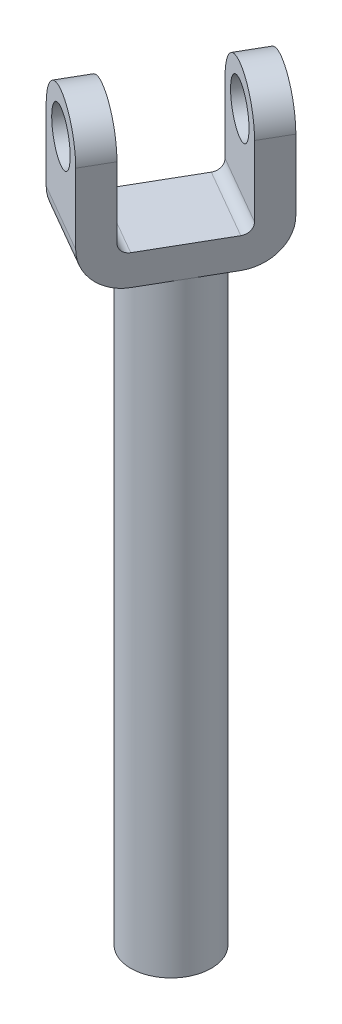
from build123d import *

# Parameters (mm, degrees)
BASE_LINK_OUTLINE_R     = 5
BASE_LINK_OUTLINE_R_2   = 4
BASE_LINK_DEPTH         = 60
SKETCH3_R               = 4
BOSS_EXTRUDE1_DEPTH     = 60
BOSS_EXTRUDE2_DEPTH     = 4
CUT_EXTRUDE1_DEPTH      = 78.510329968
CUT_EXTRUDE1_DEPTH_BACK = 78.510329968
SKETCH5_R               = 2.5


# Read off the part's stored shape, not the designer's step: base_link
with BuildPart() as part:
    # base_link outline → base_link (new body)
    with BuildSketch(Plane(origin=(0, 0, 0), x_dir=(1, 0, 0), z_dir=(0, 1, 0))):
        with Locations((30.34635, 52.561420024)):
            Circle(BASE_LINK_OUTLINE_R)
        with Locations((30.34635, 52.561420024)):
            Circle(BASE_LINK_OUTLINE_R_2, mode=Mode.SUBTRACT)
    extrude(amount=BASE_LINK_DEPTH)


with BuildPart() as body_2:
    # Sketch3 → Boss-Extrude1 (new body)
    with BuildSketch(Plane(origin=(0, 0, 0), x_dir=(1, 0, 0), z_dir=(0, 1, 0))):
        with Locations(Location((30.34635, 52.561420024, 0), (0, 0, 270))):
            Circle(SKETCH3_R)
    extrude(amount=BOSS_EXTRUDE1_DEPTH)

    # Sketch4 → Boss-Extrude2 (add, symmetric)
    with BuildSketch(Plane(origin=(0, 0, 0), x_dir=(-0.49999999999999994, 0, 0.8660254037844387), z_dir=(-0.8660254037844386, 0, -0.4999999999999999))):
        with BuildLine():
            Line((-68.6927, 75), (-65.6927, 75))
            Line((-65.6927, 75), (-65.6927, 64))
            ThreePointArc((-65.6927, 64), (-65.399806781, 63.292893219), (-64.6927, 63))
            Line((-64.6927, 63), (-56.6927, 63))
            ThreePointArc((-56.6927, 63), (-55.985593219, 63.292893219), (-55.6927, 64))
            Line((-55.6927, 64), (-55.6927, 75))
            Line((-55.6927, 75), (-52.6927, 75))
            Line((-52.6927, 75), (-52.6927, 64))
            ThreePointArc((-52.6927, 64), (-53.864272875, 61.171572875), (-56.6927, 60))
            Line((-56.6927, 60), (-64.6927, 60))
            ThreePointArc((-64.6927, 60), (-67.521127125, 61.171572875), (-68.6927, 64))
            Line((-68.6927, 64), (-68.6927, 75))
        make_face()
    extrude(amount=BOSS_EXTRUDE2_DEPTH, both=True)

    # Sketch5 → Cut-Extrude1 (cut, two sides: drawn at the far end of the back side and taken through both)
    with BuildSketch(Plane(origin=(34.34635, 0, -59.489623255), x_dir=(-0.8660254037844386, 0, -0.5), z_dir=(0.5000000000000001, 0, -0.8660254037844387)).offset(-CUT_EXTRUDE1_DEPTH_BACK)):
        with Locations((0, 71)):
            Circle(SKETCH5_R)
        with BuildLine():
            Line((-4, 71), (-4, 76))
            Line((-4, 76), (4, 76))
            Line((4, 76), (4, 71))
            ThreePointArc((4, 71), (0, 75), (-4, 71))
        make_face()
    extrude(amount=CUT_EXTRUDE1_DEPTH + CUT_EXTRUDE1_DEPTH_BACK, mode=Mode.SUBTRACT)


solid = body_2.part
